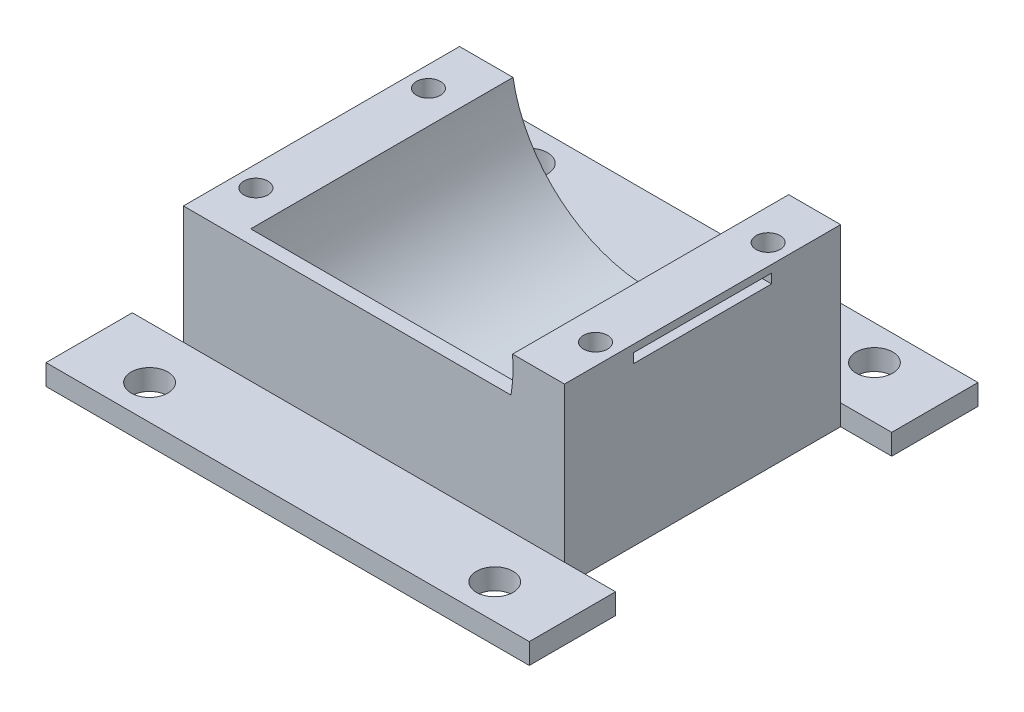
from build123d import *

# Parameters (mm, degrees)
SKETCH1_W                       = 10.823103443
SKETCH1_H                       = 51.052518719
BOSS_EXTRUDE1_DEPTH             = 50.8
SKETCH2_W                       = 177.8
SKETCH2_H                       = 31.75
BOSS_EXTRUDE2_DEPTH             = 7.62
F_1_2_START                     = -59.944
F_1_2_CLEARANCE_HOLE1_OUTLINE_R = 6.74624
F_1_2_CLEARANCE_HOLE1_DEPTH     = 7.62
SKETCH7_W                       = 140.208
SKETCH7_H                       = 43.432518719
BOSS_EXTRUDE3_DEPTH             = 5.08
CUT_EXTRUDE1_REACH              = 190.918
CUT_EXTRUDE1_END_RADIUS         = 51.203999954
SKETCH6_W                       = 50.8
SKETCH6_H                       = 3.474999908
SKETCH8_R                       = 4.4323
CUT_EXTRUDE2_DEPTH              = 138.353334223
SKETCH9_R                       = 4.4323
CUT_EXTRUDE3_DEPTH              = 132.62094122


# Read off the part's stored shape, not the designer's step: 1/2 Clearance Hole1
with BuildPart() as part:
    # Sketch1 → Boss-Extrude1 (new, symmetric)
    with BuildSketch(Plane.XY):
        with Locations((-64.692448278, -34.41774064)):
            Rectangle(SKETCH1_W, SKETCH1_H)
        with BuildLine():
            ThreePointArc((-2e-09, -59.944), (-39.117081832, -45.421768404), (-59.280896557, -8.891481281))
            Line((-59.280896557, -8.891481281), (-59.280896557, -59.944))
            Line((-59.280896557, -59.944), (-2e-09, -59.944))
        make_face()
        with BuildLine():
            Line((-50.42609614, -8.891481281), (-59.280896557, -8.891481281))
            ThreePointArc((-59.280896557, -8.891481281), (-39.117081832, -45.421768404), (-2e-09, -59.944))
            ThreePointArc((-2e-09, -59.944), (42.386808891, -42.386808892), (59.944, 0))
            ThreePointArc((59.944, 0), (59.902397652, 2.232911009), (59.777648353, 4.462722648))
            Line((59.777648353, 4.462722648), (51.009153275, 4.462722648))
            ThreePointArc((51.009153275, 4.462722648), (51.155265092, 2.233487109), (51.203999954, 0))
            ThreePointArc((51.203999954, 0), (4.462722648, -51.009153275), (-50.42609614, -8.891481281))
        make_face()
        with BuildLine():
            ThreePointArc((59.944, 0), (42.386808891, -42.386808892), (-2e-09, -59.944))
            Line((-2e-09, -59.944), (59.944, -59.944))
            Line((59.944, -59.944), (59.944, 0))
        make_face()
        with BuildLine():
            Line((70.104, 4.462722648), (59.777648353, 4.462722648))
            ThreePointArc((59.777648353, 4.462722648), (59.902397652, 2.232911009), (59.944, 0))
            Line((59.944, 0), (59.944, -59.944))
            Line((59.944, -59.944), (70.104, -59.944))
            Line((70.104, -59.944), (70.104, 4.462722648))
        make_face()
    extrude(amount=BOSS_EXTRUDE1_DEPTH, both=True)

    # Sketch2 → Boss-Extrude2 (add)
    with BuildSketch(Plane.XZ.offset(59.944)):
        with Locations((0, 66.675)):
            Rectangle(SKETCH2_W, SKETCH2_H)
    boss_extrude2 = extrude(amount=-BOSS_EXTRUDE2_DEPTH)

    # 1/2 Clearance Hole1 outline → 1/2 Clearance Hole1 (cut)
    with BuildSketch(Plane(origin=(0, 0, 0), x_dir=(1, 0, 0), z_dir=(0, 1, 0)).offset(F_1_2_START)):
        with Locations((63.5, -69.85)):
            Circle(F_1_2_CLEARANCE_HOLE1_OUTLINE_R)
        with Locations((-63.5, -69.85)):
            Circle(F_1_2_CLEARANCE_HOLE1_OUTLINE_R)
    f_1_2_clearance_hole1 = extrude(amount=F_1_2_CLEARANCE_HOLE1_DEPTH, mode=Mode.SUBTRACT)

    # Mirror1: Boss-Extrude2, 1/2 Clearance Hole1 across plane
    add(boss_extrude2.mirror(Plane.XY))
    add(f_1_2_clearance_hole1.mirror(Plane.XY), mode=Mode.SUBTRACT)

    # Sketch7 → Boss-Extrude3 (add)
    with BuildSketch(Plane.XY.offset(50.8)):
        with Locations((0, -30.607740641)):
            Rectangle(SKETCH7_W, SKETCH7_H)
    extrude(amount=-BOSS_EXTRUDE3_DEPTH)

    # Cut-Extrude1: up to this cylinder (the profile starts outside it)
    cut_extrude1_end = Plane(origin=(0, 0, 0), z_dir=(0, 0, 1)) * Cylinder(CUT_EXTRUDE1_END_RADIUS, 485.243999908, mode=Mode.PRIVATE)
    # Sketch6 → Cut-Extrude1 (cut, up to the surface)
    with BuildSketch(Plane(origin=(70.104, 0, 0), x_dir=(0, 0, -1), z_dir=(1, 0, 0)), mode=Mode.PRIVATE) as cut_extrude1_sk1:
        Rectangle(SKETCH6_W, SKETCH6_H)
    cut_extrude1_tool1 = extrude(cut_extrude1_sk1.sketch, amount=-CUT_EXTRUDE1_REACH, mode=Mode.PRIVATE) - cut_extrude1_end
    add(cut_extrude1_tool1.solids().sort_by_distance((70.104, 0, 0))[0], mode=Mode.SUBTRACT)

    # Sketch8 → Cut-Extrude2 (cut, through all)
    with BuildSketch(Plane(origin=(0, 4.462722648, 0), x_dir=(1, 0, 0), z_dir=(0, 1, 0))):
        with Locations(Location((62.484, 31.75, 0), (0, 0, 180))):
            Circle(SKETCH8_R)
        with Locations(Location((62.484, -31.75, 0), (0, 0, 180))):
            Circle(SKETCH8_R)
    extrude(amount=-CUT_EXTRUDE2_DEPTH, mode=Mode.SUBTRACT)

    # Sketch9 → Cut-Extrude3 (cut, through all)
    with BuildSketch(Plane(origin=(0, -8.891481281, 0), x_dir=(1, 0, 0), z_dir=(0, 1, 0))):
        with Locations(Location((-62.484, 31.75, 0), (0, 0, 270))):
            Circle(SKETCH9_R)
        with Locations(Location((-62.484, -31.75, 0), (0, 0, 270))):
            Circle(SKETCH9_R)
    extrude(amount=-CUT_EXTRUDE3_DEPTH, mode=Mode.SUBTRACT)


solid = part.part
